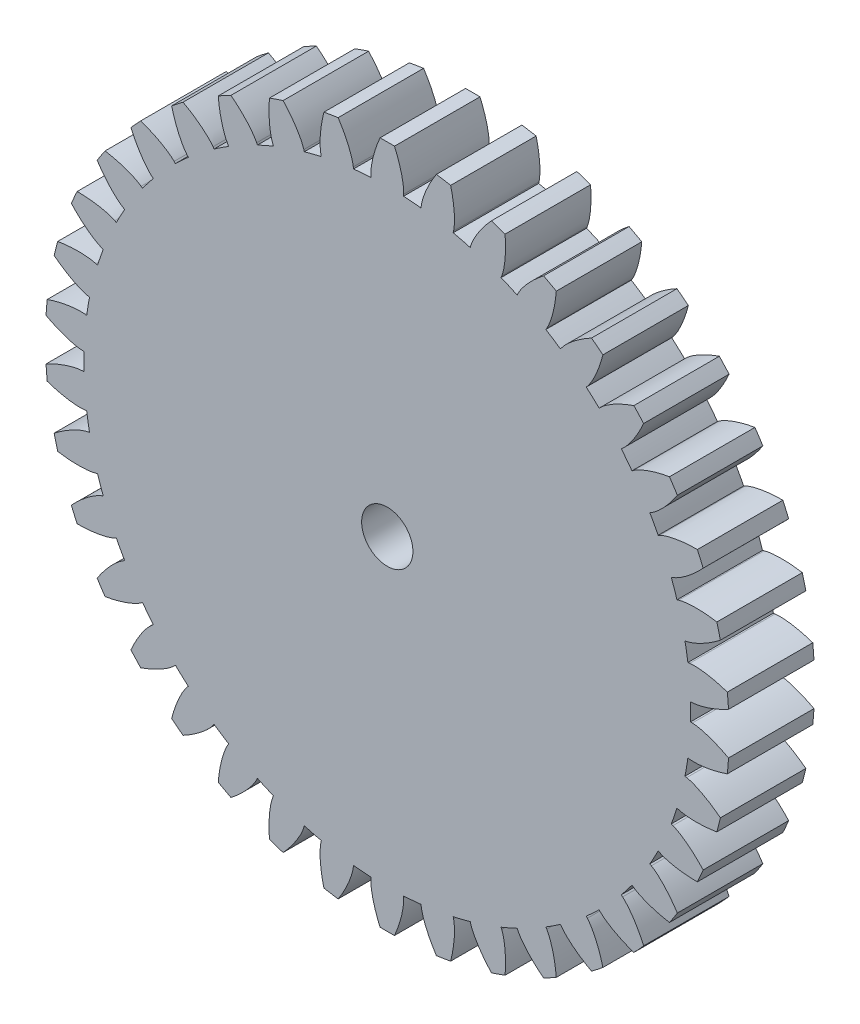
from build123d import *

# Parameters (mm, degrees)
SKETCH_1_R               = 20
SKETCH_1_R_2             = 1.5
EXTRUDE_1_DEPTH          = 5
CUT_EXTRUDE_1_DEPTH      = 29.722813233
PATTERN_CIRCULAR_1_COUNT = 38
PATTERN_CIRCULAR_1_ANGLE = 350.526315789


with BuildPart() as part:
    # 草图1 → 凸台-拉伸1 (new body)
    with BuildSketch(Plane.XY):
        Circle(SKETCH_1_R)
        Circle(SKETCH_1_R_2, mode=Mode.SUBTRACT)
    extrude(amount=EXTRUDE_1_DEPTH)

    # 草图1<3> → 切除-拉伸1 (cut, through all)
    with BuildSketch(Plane.XY):
        with BuildLine():
            Line((17.846711382, 0.515669315), (17.74259504, 0.51266094))
            ThreePointArc((17.74259504, 0.51266094), (17.748148664, 0.256357208), (17.75, 0))
            ThreePointArc((17.75, 0), (17.748148664, -0.256357208), (17.74259504, -0.51266094))
            Line((17.74259504, -0.51266094), (17.846711382, -0.515669315))
            add(Edge.make_bspline(
                [(17.846711382, -0.515669315), (17.880667469, -0.516650454), (17.948426356, -0.520699403), (18.083329755, -0.537040764), (18.337502837, -0.584014858), (18.67330164, -0.672655367), (19.132391473, -0.832101688), (19.522869081, -1.004330058), (19.794591125, -1.140509077), (19.954413253, -1.226094191), (19.962127011, -1.23023786)],
                knots=[0, 0, 0, 0, 0, 0.001401017, 0.002802034, 0.005604068, 0.010661158, 0.015718248, 0.022839082, 0.023200461, 0.023200461, 0.023200461, 0.023200461, 0.023200461], degree=4))
            ThreePointArc((19.962127011, -1.23023786), (19.990529511, -0.615410342), (20, 0))
            ThreePointArc((20, 0), (19.990529511, 0.615410342), (19.962127011, 1.23023786))
            add(Edge.make_bspline(
                [(17.846711382, 0.515669315), (17.880667469, 0.516650454), (17.948426356, 0.520699403), (18.083329755, 0.537040764), (18.337502837, 0.584014858), (18.67330164, 0.672655367), (19.132391473, 0.832101688), (19.522869081, 1.004330058), (19.794591125, 1.140509077), (19.954413253, 1.226094191), (19.962127011, 1.23023786)],
                knots=[0, 0, 0, 0, 0, 0.001401017, 0.002802034, 0.005604068, 0.010661158, 0.015718248, 0.022839082, 0.023200461, 0.023200461, 0.023200461, 0.023200461, 0.023200461], degree=4))
        make_face()
    cut_extrude_1 = extrude(amount=CUT_EXTRUDE_1_DEPTH, mode=Mode.SUBTRACT)

    # 阵列(圆周)1: 切除-拉伸1 ×38 about axis
    pattern_circular_1_axis = Axis((0, 0, 5), (0, 0, 1))
    for i in range(1, PATTERN_CIRCULAR_1_COUNT):
        add(cut_extrude_1.rotate(pattern_circular_1_axis, i * PATTERN_CIRCULAR_1_ANGLE / (PATTERN_CIRCULAR_1_COUNT - 1)), mode=Mode.SUBTRACT)


solid = part.part
